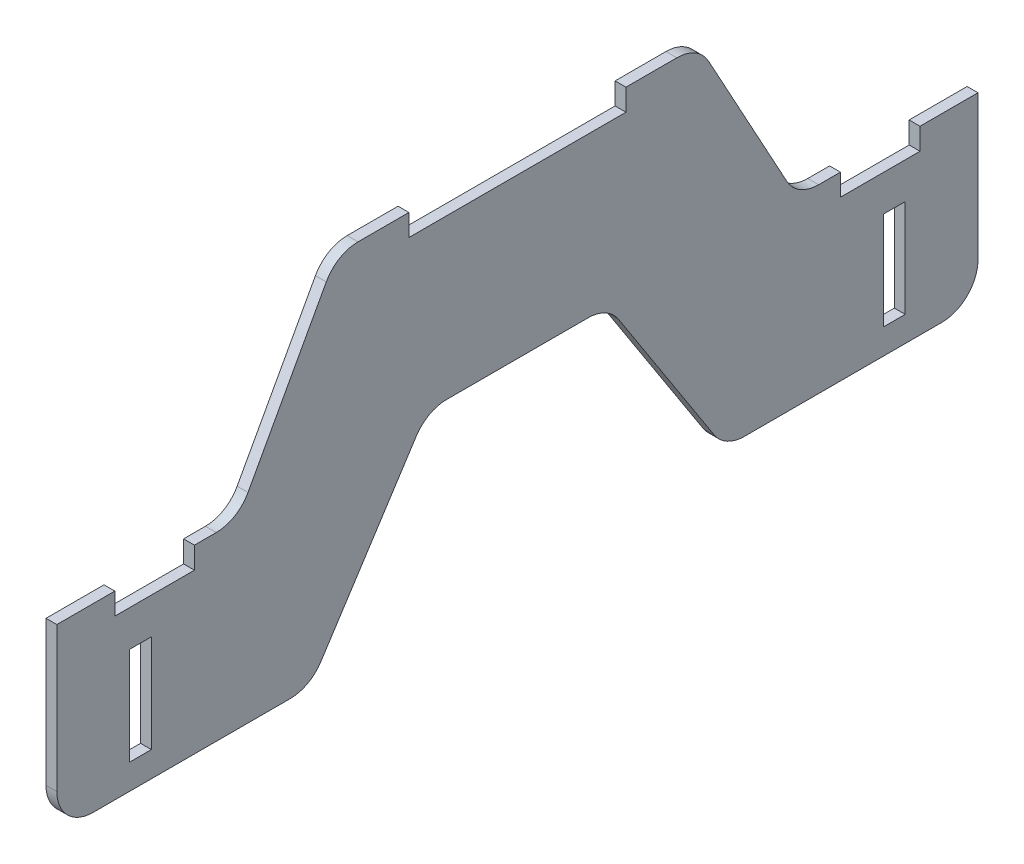
from build123d import *

# Parameters (mm, degrees)
SKETCH2_W           = 6
SKETCH2_H           = 27
BOSS_EXTRUDE1_DEPTH = 3


with BuildPart() as part:
    # Sketch2 → Boss-Extrude1 (new body)
    with BuildSketch(Plane(origin=(0, 0, 0), x_dir=(0, 0, -1), z_dir=(1, 0, 0))):
        with BuildLine():
            Line((10, -137.70232204), (64.557762355, -137.70232204))
            ThreePointArc((64.557762355, -137.70232204), (69.3379498, -136.485818382), (72.955114142, -133.132283638))
            Line((72.955114142, -133.132283638), (99.376278754, -92.272360441))
            ThreePointArc((99.376278754, -92.272360441), (102.993443097, -88.918825697), (107.773630541, -87.70232204))
            Line((107.773630541, -87.70232204), (146.889155251, -87.70232204))
            ThreePointArc((146.889155251, -87.70232204), (151.669342696, -88.918825697), (155.286507039, -92.272360441))
            Line((155.286507039, -92.272360441), (181.70767165, -133.132283638))
            ThreePointArc((181.70767165, -133.132283638), (185.324835993, -136.485818382), (190.105023438, -137.70232204))
            Line((190.105023438, -137.70232204), (244.662785793, -137.70232204))
            ThreePointArc((244.662785793, -137.70232204), (251.733853605, -134.773389851), (254.662785793, -127.70232204))
            Line((254.662785793, -127.70232204), (254.662785793, -100.70232204))
            Line((254.662785793, -100.70232204), (254.662785793, -87.70232204))
            Line((254.662785793, -87.70232204), (244.662785793, -87.70232204))
            Line((244.662785793, -87.70232204), (238.627896267, -87.70232204))
            Line((238.627896267, -87.70232204), (238.627896267, -93.70232204))
            Line((238.627896267, -93.70232204), (216.627896267, -93.70232204))
            Line((216.627896267, -93.70232204), (216.627896267, -87.70232204))
            Line((216.627896267, -87.70232204), (210.593006742, -87.70232204))
            ThreePointArc((210.593006742, -87.70232204), (205.492248957, -86.303616711), (201.818382591, -82.498776043))
            Line((201.818382591, -82.498776043), (180.175796098, -42.905868036))
            ThreePointArc((180.175796098, -42.905868036), (176.501929732, -39.101027368), (171.401171947, -37.70232204))
            Line((171.401171947, -37.70232204), (157.331392896, -37.70232204))
            Line((157.331392896, -37.70232204), (157.331392896, -43.70232204))
            Line((157.331392896, -43.70232204), (97.331392896, -43.70232204))
            Line((97.331392896, -43.70232204), (97.331392896, -37.70232204))
            Line((97.331392896, -37.70232204), (83.261613846, -37.70232204))
            ThreePointArc((83.261613846, -37.70232204), (78.160856061, -39.101027368), (74.486989695, -42.905868036))
            Line((74.486989695, -42.905868036), (52.844403202, -82.498776043))
            ThreePointArc((52.844403202, -82.498776043), (49.170536836, -86.303616711), (44.069779051, -87.70232204))
            Line((44.069779051, -87.70232204), (38.034889525, -87.70232204))
            Line((38.034889525, -87.70232204), (38.034889525, -93.70232204))
            Line((38.034889525, -93.70232204), (16.034889525, -93.70232204))
            Line((16.034889525, -93.70232204), (16.034889525, -87.70232204))
            Line((16.034889525, -87.70232204), (10, -87.70232204))
            Line((10, -87.70232204), (0, -87.70232204))
            Line((0, -87.70232204), (0, -100.70232204))
            Line((0, -100.70232204), (0, -127.70232204))
            ThreePointArc((0, -127.70232204), (2.928932188, -134.773389851), (10, -137.70232204))
        make_face()
        with Locations((231.532785793, -117.20232204)):
            Rectangle(SKETCH2_W, SKETCH2_H, mode=Mode.SUBTRACT)
        with Locations((23.13, -117.20232204)):
            Rectangle(SKETCH2_W, SKETCH2_H, mode=Mode.SUBTRACT)
    extrude(amount=BOSS_EXTRUDE1_DEPTH)


solid = part.part
